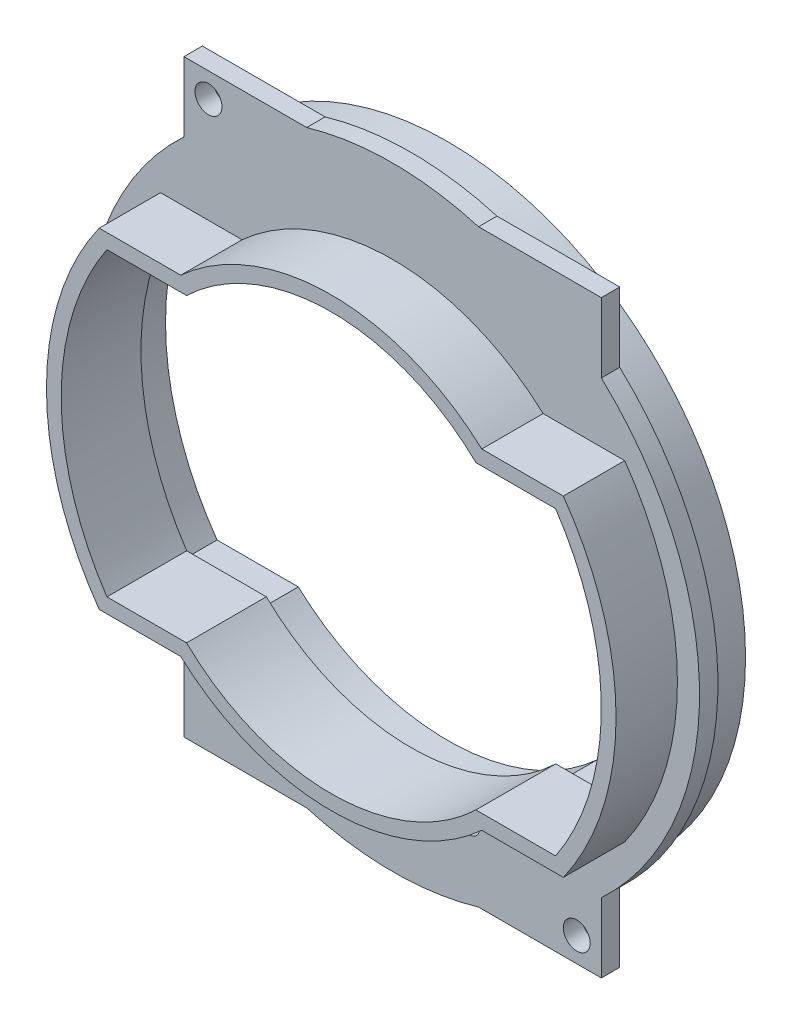
from build123d import *

# Parameters (mm, degrees)
SKETCH_1_R          = 25
EXTRUDE_1_DEPTH     = 1.5
EXTRUDE_2_DEPTH     = 5
SKETCH_5_R          = 24.25
EXTRUDE_4_DEPTH     = 3
EXTRUDE_5_DEPTH     = 1.5
SKETCH_7_R          = 0.5
CUT_EXTRUDE_2_DEPTH = 37.609425016
SKETCH_8_R          = 0.8
CUT_EXTRUDE_3_DEPTH = 3.5
SKETCH_9_R          = 1.1
CUT_EXTRUDE_4_DEPTH = 10


with BuildPart() as part:
    # 草图1 → 凸台-拉伸1 (new body)
    with BuildSketch(Plane.XY):
        Circle(SKETCH_1_R)
        with BuildLine():
            Line((-18.273956879, 12.25), (-11.787175234, 12.25))
            ThreePointArc((-11.787175234, 12.25), (0, 17), (11.787175234, 12.25))
            Line((11.787175234, 12.25), (18.273956879, 12.25))
            ThreePointArc((18.273956879, 12.25), (22, 0), (18.273956879, -12.25))
            Line((18.273956879, -12.25), (11.787175234, -12.25))
            ThreePointArc((11.787175234, -12.25), (0, -17), (-11.787175234, -12.25))
            Line((-11.787175234, -12.25), (-18.273956879, -12.25))
            ThreePointArc((-18.273956879, -12.25), (-22, 0), (-18.273956879, 12.25))
        make_face(mode=Mode.SUBTRACT)
    extrude(amount=EXTRUDE_1_DEPTH)

    # 草图2 → 凸台-拉伸2 (add)
    with BuildSketch(Plane.XY.offset(1.5)):
        with BuildLine():
            Line((-18.903372715, 13.45), (-12.261219352, 13.45))
            ThreePointArc((-12.261219352, 13.45), (0, 18.2), (12.261219352, 13.45))
            Line((12.261219352, 13.45), (18.903372715, 13.45))
            ThreePointArc((18.903372715, 13.45), (23.2, 0), (18.903372715, -13.45))
            Line((18.903372715, -13.45), (12.261219352, -13.45))
            ThreePointArc((12.261219352, -13.45), (0, -18.2), (-12.261219352, -13.45))
            Line((-12.261219352, -13.45), (-18.903372715, -13.45))
            ThreePointArc((-18.903372715, -13.45), (-23.2, 0), (-18.903372715, 13.45))
        make_face()
        with BuildLine():
            Line((-18.273956879, 12.25), (-11.787175234, 12.25))
            ThreePointArc((-11.787175234, 12.25), (0, 17), (11.787175234, 12.25))
            Line((11.787175234, 12.25), (18.273956879, 12.25))
            ThreePointArc((18.273956879, 12.25), (22, 0), (18.273956879, -12.25))
            Line((18.273956879, -12.25), (11.787175234, -12.25))
            ThreePointArc((11.787175234, -12.25), (0, -17), (-11.787175234, -12.25))
            Line((-11.787175234, -12.25), (-18.273956879, -12.25))
            ThreePointArc((-18.273956879, -12.25), (-22, 0), (-18.273956879, 12.25))
        make_face(mode=Mode.SUBTRACT)
    extrude(amount=EXTRUDE_2_DEPTH)

    # 草图5 → 凸台-拉伸4 (add)
    with BuildSketch(Plane(origin=(0, 0, 0), x_dir=(-1, 0, 0), z_dir=(0, 0, -1))):
        Circle(SKETCH_5_R)
        with BuildLine():
            Line((-18.799933511, -13.25), (-12.183492931, -13.25))
            ThreePointArc((-12.183492931, -13.25), (0, -18), (12.183492931, -13.25))
            Line((12.183492931, -13.25), (18.799933511, -13.25))
            ThreePointArc((18.799933511, -13.25), (23, 0), (18.799933511, 13.25))
            Line((18.799933511, 13.25), (12.183492931, 13.25))
            ThreePointArc((12.183492931, 13.25), (0, 18), (-12.183492931, 13.25))
            Line((-12.183492931, 13.25), (-18.799933511, 13.25))
            ThreePointArc((-18.799933511, 13.25), (-23, 0), (-18.799933511, -13.25))
        make_face(mode=Mode.SUBTRACT)
    extrude(amount=EXTRUDE_4_DEPTH)

    # 草图6 → 凸台-拉伸5 (add)
    with BuildSketch(Plane.XY):
        with BuildLine():
            Line((-17, -16.941074346), (-17, -24))
            Line((-17, -24), (0, -24))
            ThreePointArc((0, -24), (-9.203646443, -22.16512784), (-17, -16.941074346))
        make_face()
        with BuildLine():
            ThreePointArc((17, -16.941074346), (9.203646443, -22.16512784), (0, -24))
            Line((0, -24), (17, -24))
            Line((17, -24), (17, -16.941074346))
        make_face()
        with BuildLine():
            Line((-17, 24), (-17, 16.941074346))
            ThreePointArc((-17, 16.941074346), (-9.203646443, 22.16512784), (0, 24))
            Line((0, 24), (-17, 24))
        make_face()
        with BuildLine():
            ThreePointArc((0, 24), (9.203646443, 22.16512784), (17, 16.941074346))
            Line((17, 16.941074346), (17, 24))
            Line((17, 24), (0, 24))
        make_face()
    extrude(amount=EXTRUDE_5_DEPTH)

    # 草图7 → 切除-拉伸2 (cut, through all)
    with BuildSketch(Plane(origin=(0, 0, -3), x_dir=(-1, 0, 0), z_dir=(0, 0, -1))):
        with Locations((-12.857243394, -14.660876246)):
            Circle(SKETCH_7_R)
        with Locations((-10.833619544, -16.21365744)):
            Circle(SKETCH_7_R)
        with Locations((-8.624629459, -17.48901846)):
            Circle(SKETCH_7_R)
        with Locations((-6.268069573, -18.465137525)):
            Circle(SKETCH_7_R)
        with Locations((-3.804261279, -19.125312968)):
            Circle(SKETCH_7_R)
        with Locations((-1.27536102, -19.458249003)):
            Circle(SKETCH_7_R)
        with Locations((1.27536102, -19.458249003)):
            Circle(SKETCH_7_R)
        with Locations((3.804261279, -19.125312968)):
            Circle(SKETCH_7_R)
        with Locations((6.268069573, -18.465137525)):
            Circle(SKETCH_7_R)
        with Locations((8.624629459, -17.48901846)):
            Circle(SKETCH_7_R)
    extrude(amount=-CUT_EXTRUDE_2_DEPTH, mode=Mode.SUBTRACT)

    # 草图8 → 切除-拉伸3 (cut)
    with BuildSketch(Plane.XY.offset(1.5)):
        with Locations((12.857243394, -14.660876246)):
            Circle(SKETCH_8_R)
        with Locations((10.833619544, -16.21365744)):
            Circle(SKETCH_8_R)
        with Locations((8.624629459, -17.48901846)):
            Circle(SKETCH_8_R)
        with Locations((6.268069573, -18.465137525)):
            Circle(SKETCH_8_R)
        with Locations((3.804261279, -19.125312968)):
            Circle(SKETCH_8_R)
        with Locations((1.27536102, -19.458249003)):
            Circle(SKETCH_8_R)
        with Locations((-1.27536102, -19.458249003)):
            Circle(SKETCH_8_R)
        with Locations((-3.804261279, -19.125312968)):
            Circle(SKETCH_8_R)
        with Locations((-6.268069573, -18.465137525)):
            Circle(SKETCH_8_R)
        with Locations((-8.624629459, -17.48901846)):
            Circle(SKETCH_8_R)
    extrude(amount=-CUT_EXTRUDE_3_DEPTH, mode=Mode.SUBTRACT)

    # 草图9 → 切除-拉伸4 (cut)
    with BuildSketch(Plane.XY.offset(1.5)):
        with Locations((-15, 22)):
            Circle(SKETCH_9_R)
        with Locations((15, -22)):
            Circle(SKETCH_9_R)
    extrude(amount=-CUT_EXTRUDE_4_DEPTH, mode=Mode.SUBTRACT)


solid = part.part
